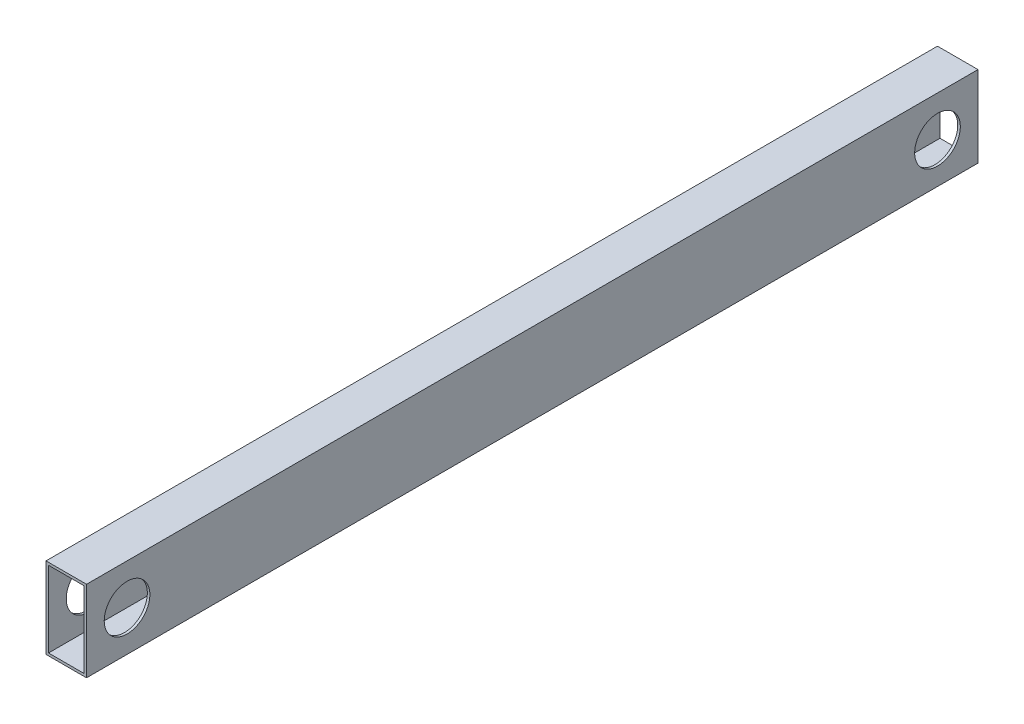
from build123d import *

# Parameters (mm, degrees)
SKETCH1_W               = 25.4
SKETCH1_H               = 50.8
SKETCH1_W_2             = 22.225
SKETCH1_H_2             = 47.625
BOSS_EXTRUDE1_DEPTH     = 558.8
CUT_EXTRUDE1_DEPTH      = 562.678947442
CUT_EXTRUDE1_DEPTH_BACK = 562.678947442
SKETCH2_R               = 14.3129


with BuildPart() as part:
    # Sketch1 → Boss-Extrude1 (new body)
    with BuildSketch(Plane.XY):
        with Locations((12.7, 25.4)):
            Rectangle(SKETCH1_W, SKETCH1_H)
        with Locations((12.7, 25.4)):
            Rectangle(SKETCH1_W_2, SKETCH1_H_2, mode=Mode.SUBTRACT)
    extrude(amount=BOSS_EXTRUDE1_DEPTH)

    # Sketch2 → Cut-Extrude1 (cut, two sides: drawn at the far end of the back side and taken through both)
    with BuildSketch(Plane(origin=(25.4, 0, 0), x_dir=(0, 0, -1), z_dir=(1, 0, 0)).offset(-CUT_EXTRUDE1_DEPTH_BACK)):
        with Locations((-25.4, 25.4)):
            Circle(SKETCH2_R)
        with Locations((-533.4, 25.4)):
            Circle(SKETCH2_R)
    extrude(amount=CUT_EXTRUDE1_DEPTH + CUT_EXTRUDE1_DEPTH_BACK, mode=Mode.SUBTRACT)


solid = part.part
